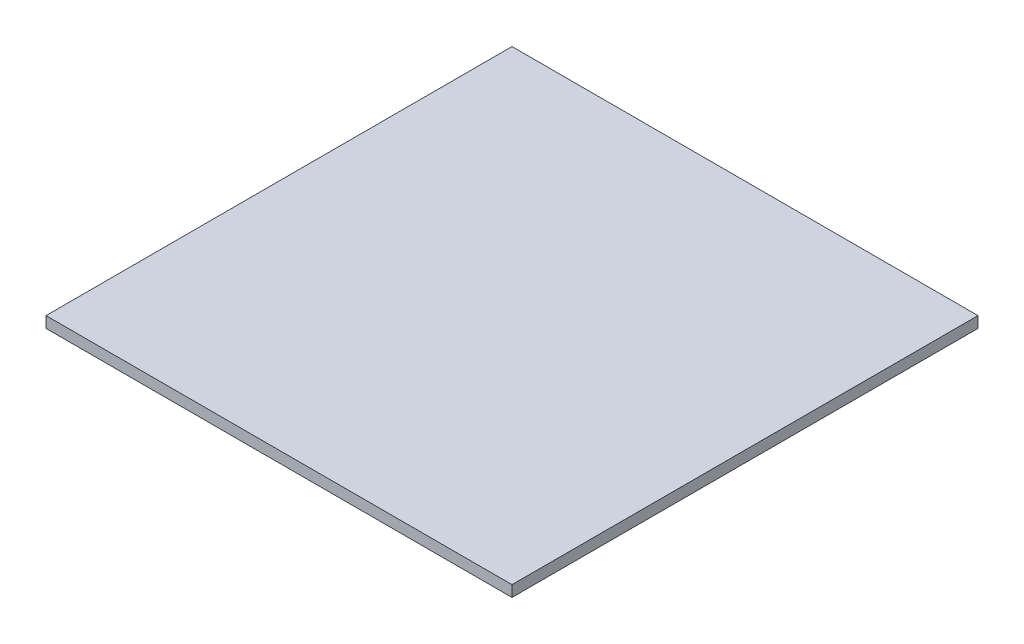
from build123d import *

# Parameters (mm, degrees)
SKETCH1_W           = 400
SKETCH1_H           = 400
BOSS_EXTRUDE1_DEPTH = 9.525


with BuildPart() as part:
    # Sketch1 → Boss-Extrude1 (new body)
    with BuildSketch(Plane(origin=(0, 0, 0), x_dir=(1, 0, 0), z_dir=(0, 1, 0))):
        Rectangle(SKETCH1_W, SKETCH1_H)
    extrude(amount=BOSS_EXTRUDE1_DEPTH)


solid = part.part
